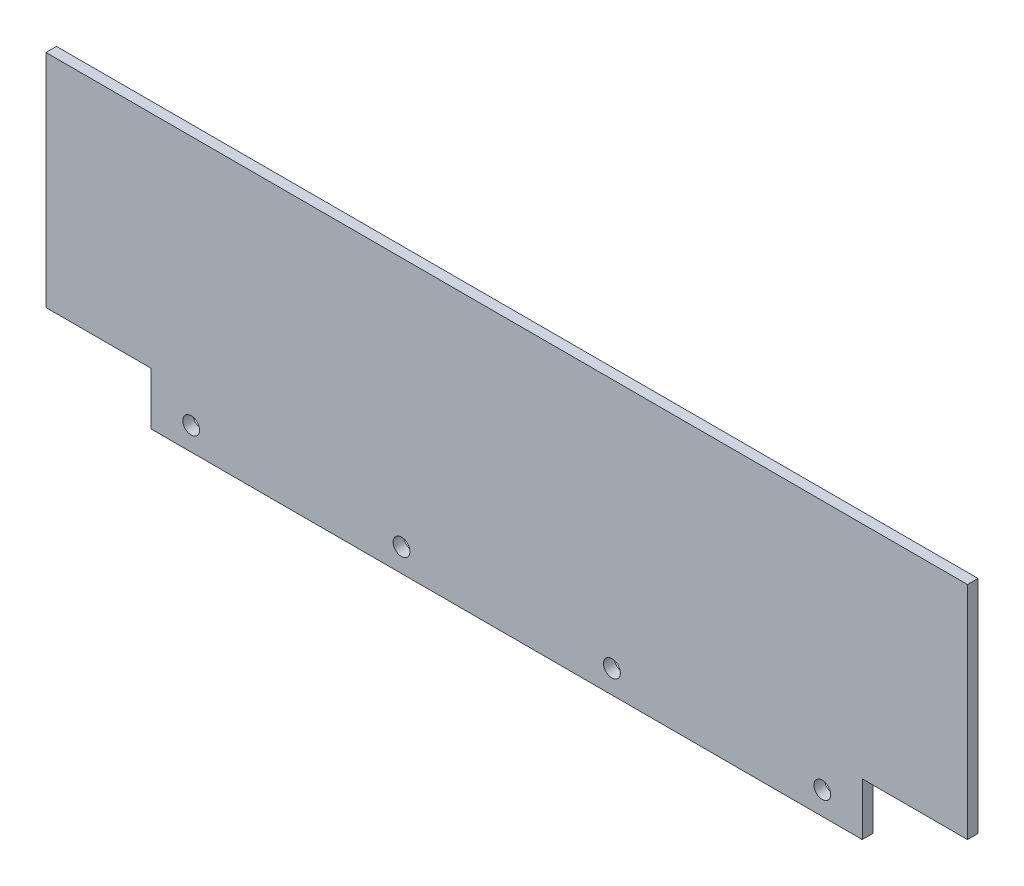
from build123d import *

# Parameters (mm, degrees)
CROQUIS1_R              = 4
SALIENTE_EXTRUIR1_DEPTH = 5


with BuildPart() as part:
    # Croquis1 → Saliente-Extruir1 (new body)
    with BuildSketch(Plane.XY):
        Polygon((0, 0), (-338, 0), (-338, 25), (-388, 25), (-388, 130), (50, 130), (50, 25), (0, 25), align=None)
        with Locations((-319, 11)):
            Circle(CROQUIS1_R, mode=Mode.SUBTRACT)
        with Locations((-219, 11)):
            Circle(CROQUIS1_R, mode=Mode.SUBTRACT)
        with Locations((-119, 11)):
            Circle(CROQUIS1_R, mode=Mode.SUBTRACT)
        with Locations((-19, 11)):
            Circle(CROQUIS1_R, mode=Mode.SUBTRACT)
    extrude(amount=SALIENTE_EXTRUIR1_DEPTH)


solid = part.part
